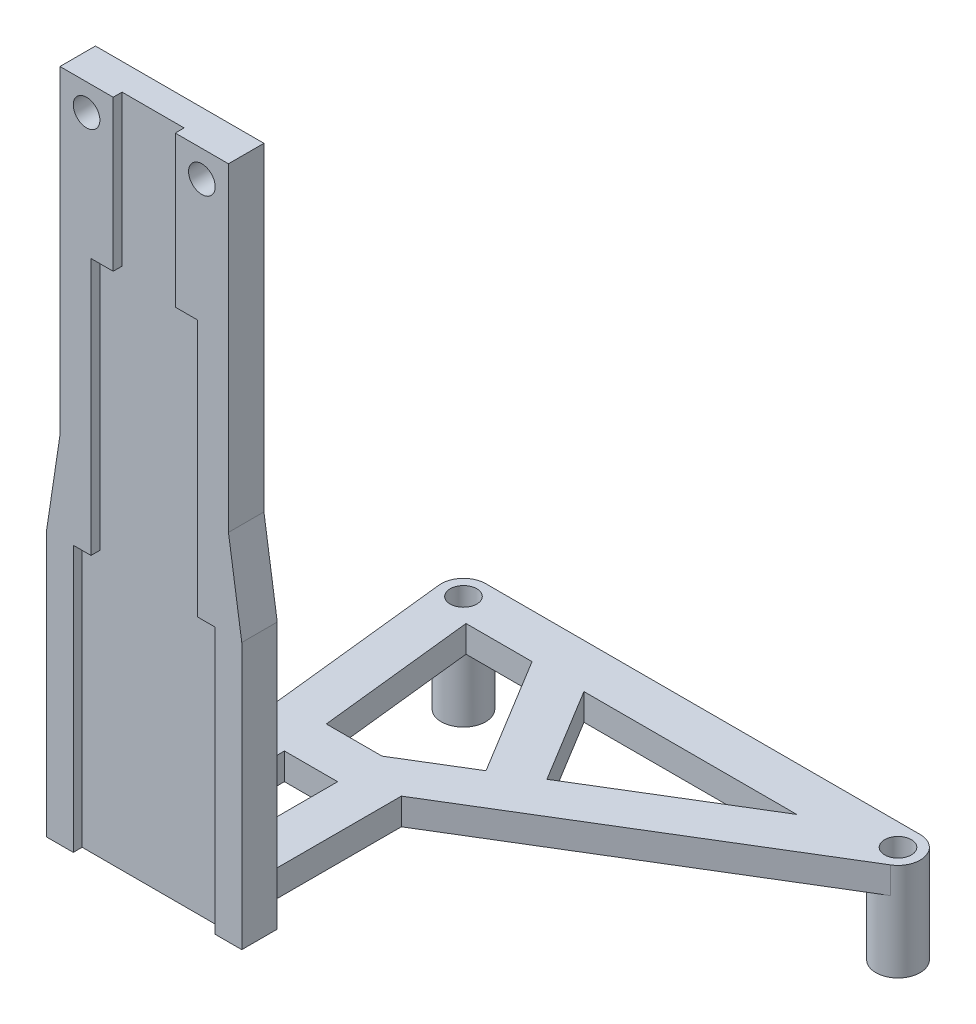
from build123d import *
from OCP.BRepFilletAPI import BRepFilletAPI_MakeChamfer

# Parameters (mm, degrees)
ESQUISSE1_R             = 2.5
ESQUISSE1_R_2           = 1.5
BOSS_EXTRU_1_DEPTH      = 8
BOSS_EXTRU_1_2_DEPTH    = 8
ESQUISSE2_R             = 1.5
BOSS_EXTRU_2_DEPTH      = 3
ESQUISSE3_W             = 6
ESQUISSE3_H             = 12.810919071
ENL_V_MAT_EXTRU_1_DEPTH = 3
BOSS_EXTRU_3_START      = -3
BOSS_EXTRU_3_DEPTH      = 30
BOSS_EXTRU_5_DEPTH      = 29
BOSS_EXTRU_6_DEPTH      = 17
ESQUISSE7_R             = 1.5
ENL_V_MAT_EXTRU_2_DEPTH = 100.872418615
CHANFREIN1_SIZE         = 1.5
CHANFREIN1_SIZE_2       = 10


with BuildPart() as part:
    # Esquisse1 → Boss.-Extru.1 (new body)
    with BuildSketch(Plane(origin=(0, 0, 0), x_dir=(1, 0, 0), z_dir=(0, 1, 0))):
        with Locations(Location((-24.5, 0, 0), (0, 0, 270))):
            Circle(ESQUISSE1_R)
        with Locations(Location((-24.5, 0, 0), (0, 0, 270))):
            Circle(ESQUISSE1_R_2, mode=Mode.SUBTRACT)
    extrude(amount=BOSS_EXTRU_1_DEPTH)



with BuildPart() as body_2:
    # Esquisse1 → Boss.-Extru.1 2 (new body)
    with BuildSketch(Plane(origin=(0, 0, 0), x_dir=(1, 0, 0), z_dir=(0, 1, 0))):
        with Locations(Location((24.5, 0, 0), (0, 0, 270))):
            Circle(ESQUISSE1_R)
        with Locations(Location((24.5, 0, 0), (0, 0, 270))):
            Circle(ESQUISSE1_R_2, mode=Mode.SUBTRACT)
    extrude(amount=BOSS_EXTRU_1_2_DEPTH)


with BuildPart() as part_1:
    add(part.part)

    add(body_2.part)  # Boss.-Extru.2 merges body 2
    # Esquisse2 → Boss.-Extru.2 (add)
    with BuildSketch(Plane(origin=(0, 8, 0), x_dir=(1, 0, 0), z_dir=(0, 1, 0))):
        with BuildLine():
            Line((-24.5, 2.5), (24.5, 2.5))
            ThreePointArc((24.5, 2.5), (26.907248053, 0.674653105), (25.799245899, -2.13587455))
            Line((25.799245899, -2.13587455), (-8.5, -23))
            Line((-8.5, -23), (-8.5, -43))
            Line((-8.5, -43), (-24.5, -43))
            Line((-24.5, -43), (-24.5, -23))
            Line((-24.5, -23), (-26.985187688, -0.27173913))
            ThreePointArc((-26.985187688, -0.27173913), (-26.361363455, 1.668929623), (-24.5, 2.5))
        make_face()
        with Locations(Location((-24.5, 0, 0), (0, 0, 270))):
            Circle(ESQUISSE2_R, mode=Mode.SUBTRACT)
        with Locations(Location((24.5, 0, 0), (0, 0, 270))):
            Circle(ESQUISSE2_R, mode=Mode.SUBTRACT)
    extrude(amount=BOSS_EXTRU_2_DEPTH)

    # Esquisse3 → Enlèv. mat.-Extru.1 (cut)
    with BuildSketch(Plane(origin=(0, 11, 0), x_dir=(1, 0, 0), z_dir=(0, 1, 0))):
        Polygon((-6.206238259, -15.752308167), (-14.267576426, -2.5), (-21.711740643, -2.5), (-19.777554548, -20.189080929), (-13.5, -20.189080929), align=None)
        Polygon((-8.415172783, -2.5), (-1.934489158, -13.153816369), (15.579682155, -2.5), align=None)
        with Locations((-16.5, -31.594540464)):
            Rectangle(ESQUISSE3_W, ESQUISSE3_H)
    extrude(amount=-ENL_V_MAT_EXTRU_1_DEPTH, mode=Mode.SUBTRACT)

    # Esquisse4 → Boss.-Extru.3 (add)
    with BuildSketch(Plane(origin=(0, 11, 0), x_dir=(1, 0, 0), z_dir=(0, 1, 0)).offset(BOSS_EXTRU_3_START)):
        Polygon((-24.5, -44), (-27.5, -44), (-27.5, -40), (-24.5, -40), (-8.5, -40), (-5.5, -40), (-5.5, -44), (-8.5, -44), (-8.5, -43), (-24.5, -43), align=None)
    extrude(amount=BOSS_EXTRU_3_DEPTH)

    # Esquisse5 → Boss.-Extru.5 (add)
    with BuildSketch(Plane(origin=(0, 38, 0), x_dir=(1, 0, 0), z_dir=(0, 1, 0))):
        Polygon((-26, -44), (-22.5, -44), (-22.5, -43), (-10.5, -43), (-10.5, -44), (-7, -44), (-7, -40), (-26, -40), align=None)
    extrude(amount=BOSS_EXTRU_5_DEPTH)

    # Esquisse6 → Boss.-Extru.6 (add)
    with BuildSketch(Plane(origin=(0, 67, 0), x_dir=(1, 0, 0), z_dir=(0, 1, 0))):
        Polygon((-20, -44), (-20, -43), (-13, -43), (-13, -44), (-7, -44), (-7, -40), (-26, -40), (-26, -44), align=None)
    extrude(amount=BOSS_EXTRU_6_DEPTH)

    # Esquisse7 → Enlèv. mat.-Extru.2 (cut, through all)
    with BuildSketch(Plane.XY.offset(44)):
        with Locations((-23, 81)):
            Circle(ESQUISSE7_R)
        with Locations((-10, 81)):
            Circle(ESQUISSE7_R)
    extrude(amount=-ENL_V_MAT_EXTRU_2_DEPTH, mode=Mode.SUBTRACT)

    # Chanfrein1
    chanfrein1_edges_1 = [part_1.edges().sort_by_distance(p)[0] for p in [
        (-26, 38, 42),
    ]]
    chanfrein1_side_1 = [part_1.faces().sort_by_distance(p)[0] for p in [
        (-26.03, 38, 42),
    ]]
    chanfrein1_edges_2 = [part_1.edges().sort_by_distance(p)[0] for p in [
        (-7, 38, 42),
    ]]
    chanfrein1_side_2 = [part_1.faces().sort_by_distance(p)[0] for p in [
        (-6.97, 38, 42),
    ]]
    chanfrein1 = BRepFilletAPI_MakeChamfer(part_1.part.solid().wrapped)
    for e in chanfrein1_edges_1:
        chanfrein1.Add(CHANFREIN1_SIZE - 0.0001, CHANFREIN1_SIZE_2 - 0.0001, e.wrapped, chanfrein1_side_1[0].wrapped)
    for e in chanfrein1_edges_2:
        chanfrein1.Add(CHANFREIN1_SIZE - 0.0001, CHANFREIN1_SIZE_2 - 0.0001, e.wrapped, chanfrein1_side_2[0].wrapped)
    add(Compound.cast(chanfrein1.Shape()), mode=Mode.REPLACE)  # a hair under: the kernel refuses the full size


solid = part_1.part
